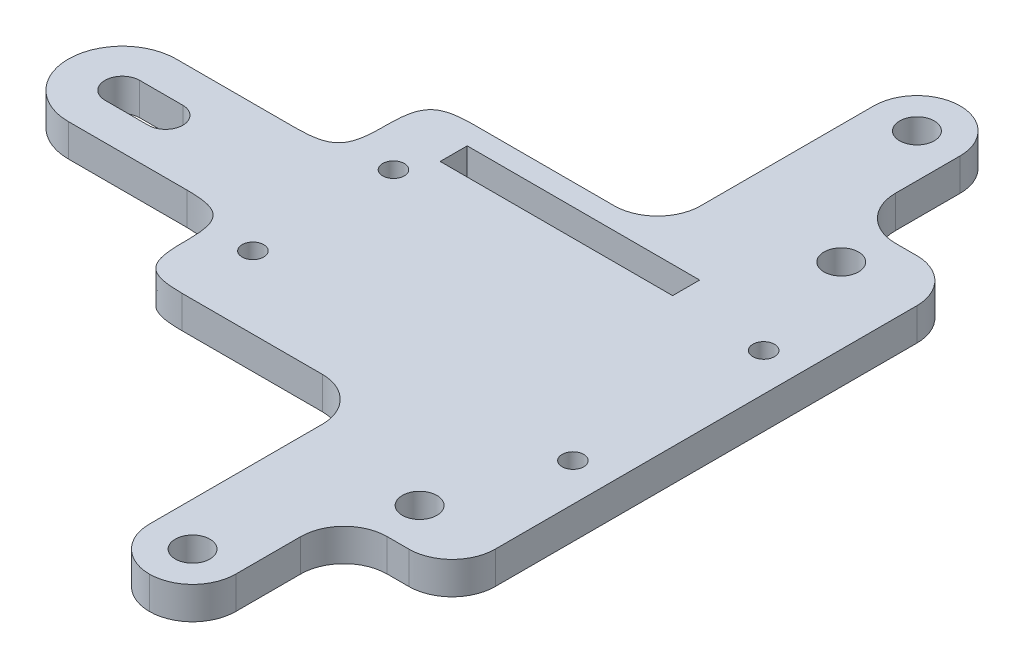
from build123d import *

# Parameters (mm, degrees)
CROQUIS1_W              = 81
CROQUIS1_H              = 47
SALIENTE_EXTRUIR1_DEPTH = 3
CORTAR_EXTRUIR2_DEPTH   = 47.920144927
CROQUIS2_R              = 1.6
CORTAR_EXTRUIR1_DEPTH   = 47.920144927
CROQUIS5_R              = 1
CROQUIS5_W              = 16
CROQUIS5_H              = 59.242740908
CROQUIS5_W_2            = 21.5
CROQUIS5_H_2            = 2.5
CORTAR_EXTRUIR4_DEPTH   = 10
CORTAR_EXTRUIR5_DEPTH   = 10
CROQUIS7_W              = 27.893037997
CROQUIS7_H              = 58.785327392
CORTAR_EXTRUIR6_DEPTH   = 10
CROQUIS8_W              = 8
CROQUIS8_H              = 24
CROQUIS8_R              = 1.6
SALIENTE_EXTRUIR2_DEPTH = 3
REDONDEO1_R             = 4
REDONDEO4_R             = 5
REDONDEO3_SIZE          = 4


# Some blends are built 0.0001 mm under size
with BuildPart() as part:
    # Croquis1 → Saliente-Extruir1 (new body)
    with BuildSketch(Plane(origin=(0, 0, 0), x_dir=(1, 0, 0), z_dir=(0, 1, 0))):
        Rectangle(CROQUIS1_W, CROQUIS1_H)
    extrude(amount=SALIENTE_EXTRUIR1_DEPTH)

    # Croquis3 → Cortar-Extruir2 (cut, through all)
    with BuildSketch(Plane(origin=(0, 3, 0), x_dir=(1, 0, 0), z_dir=(0, 1, 0))):
        Polygon((-32.5, 23.5), (23.5, 23.5), (23.5, 13.5), (-4.5, 13.5), (-4.5, 5), (-32.5, 5), align=None)
        Polygon((-32.5, -5), (-32.5, -23.5), (23.5, -23.5), (23.5, -13.5), (-4.5, -13.5), (-4.5, -5), align=None)
    extrude(amount=-CORTAR_EXTRUIR2_DEPTH, mode=Mode.SUBTRACT)

    # Croquis2 → Cortar-Extruir1 (cut, through all)
    with BuildSketch(Plane(origin=(0, 3, 0), x_dir=(1, 0, 0), z_dir=(0, 1, 0))):
        with Locations(Location((-36.5, 19.5, 0), (0, 0, 270))):
            Circle(CROQUIS2_R)
        with Locations(Location((-36.5, -19.5, 0), (0, 0, 270))):
            Circle(CROQUIS2_R)
        with Locations(Location((27.5, 19.5, 0), (0, 0, 270))):
            Circle(CROQUIS2_R)
        with Locations(Location((27.5, -19.5, 0), (0, 0, 270))):
            Circle(CROQUIS2_R)
        with Locations(Location((-36.5, 11.5, 0), (0, 0, 270))):
            Circle(CROQUIS2_R)
        with Locations(Location((-36.5, -11.5, 0), (0, 0, 270))):
            Circle(CROQUIS2_R)
    extrude(amount=-CORTAR_EXTRUIR1_DEPTH, mode=Mode.SUBTRACT)

    # Croquis5 → Cortar-Extruir4 (cut)
    with BuildSketch(Plane(origin=(0, 3, 0), x_dir=(1, 0, 0), z_dir=(0, 1, 0))):
        with Locations(Location((-0.6, 6.18, 0), (0, 0, 270))):
            Circle(CROQUIS5_R)
        with Locations(Location((31, 8.82, 0), (0, 0, 270))):
            Circle(CROQUIS5_R)
        with Locations(Location((31, -8.82, 0), (0, 0, 270))):
            Circle(CROQUIS5_R)
        with Locations(Location((-0.6, -6.82, 0), (0, 0, 270))):
            Circle(CROQUIS5_R)
        with Locations((42.5, 1.68576905)):
            Rectangle(CROQUIS5_W, CROQUIS5_H)
        with Locations((11.65, 10.25)):
            Rectangle(CROQUIS5_W_2, CROQUIS5_H_2)
    extrude(amount=-CORTAR_EXTRUIR4_DEPTH, mode=Mode.SUBTRACT)

    # Croquis6 → Cortar-Extruir5 (cut)
    with BuildSketch(Plane(origin=(0, 3, 0), x_dir=(1, 0, 0), z_dir=(0, 1, 0))):
        with BuildLine():
            Line((-19.5, 1.6), (-15.5, 1.6))
            ThreePointArc((-15.5, 1.6), (-13.9, 0), (-15.5, -1.6))
            Line((-15.5, -1.6), (-19.5, -1.6))
            ThreePointArc((-19.5, -1.6), (-21.1, 0), (-19.5, 1.6))
        make_face()
    extrude(amount=-CORTAR_EXTRUIR5_DEPTH, mode=Mode.SUBTRACT)

    # Croquis7 → Cortar-Extruir6 (cut)
    with BuildSketch(Plane(origin=(0, 3, 0), x_dir=(1, 0, 0), z_dir=(0, 1, 0))):
        with Locations((-38.446518998, -0.587422332)):
            Rectangle(CROQUIS7_W, CROQUIS7_H)
    extrude(amount=-CORTAR_EXTRUIR6_DEPTH, mode=Mode.SUBTRACT)

    # Croquis8 → Saliente-Extruir2 (add, through all)
    with BuildSketch(Plane(origin=(0, 3, 0), x_dir=(1, 0, 0), z_dir=(0, 1, 0))):
        with Locations((20.5, -25.5)):
            Rectangle(CROQUIS8_W, CROQUIS8_H)
        with Locations(Location((20.5, -33.5, 0), (0, 0, 270))):
            Circle(CROQUIS8_R, mode=Mode.SUBTRACT)
    saliente_extruir2 = extrude(amount=-SALIENTE_EXTRUIR2_DEPTH)

    # Simetría1: Saliente-Extruir2 across plane
    add(saliente_extruir2.mirror(Plane.XY))

    # Redondeo1
    redondeo1_edges = [part.edges().sort_by_distance(p)[0] for p in [
        (34.5, 1.5, 23.5),
        (34.5, 1.5, -23.5),
        (16.5, 1.5, 37.5),
        (24.5, 1.5, 37.5),
        (16.5, 1.5, 13.5),
        (24.5, 1.5, 23.5),
        (24.5, 1.5, -37.5),
        (16.5, 1.5, -37.5),
        (16.5, 1.5, -13.5),
        (24.5, 1.5, -23.5),
    ]]
    fillet(redondeo1_edges, radius=REDONDEO1_R - 0.0001)  # a hair under: the kernel refuses the full size

    # Redondeo4
    redondeo4_edges = [part.edges().sort_by_distance(p)[0] for p in [
        (-24.5, 1.5, -5),
        (-24.5, 1.5, 5),
    ]]
    fillet(redondeo4_edges, radius=REDONDEO4_R - 0.0001)  # a hair under: the kernel refuses the full size

    # Redondeo3
    # a fillet whose section is not a circle: 4 mm, written as the material it adds along each edge
    with BuildSketch(Plane(origin=(-4.5, 3, 5), x_dir=(-1, 0, 0), z_dir=(0, -1, 0))) as redondeo3_piece_1:
        with BuildLine():
            Bezier((REDONDEO3_SIZE, 0), (0, 0), (0, -REDONDEO3_SIZE), weights=[1, 1.5, 1])
            Line((0, -REDONDEO3_SIZE), (0, 0))
            Line((0, 0), (REDONDEO3_SIZE, 0))
        make_face()
    extrude(amount=3)
    with BuildSketch(Plane(origin=(-4.5, 3, -5), x_dir=(-1, 0, 0), z_dir=(0, -1, 0))) as redondeo3_piece_2:
        with BuildLine():
            Bezier((REDONDEO3_SIZE, 0), (0, 0), (0, REDONDEO3_SIZE), weights=[1, 1.5, 1])
            Line((0, REDONDEO3_SIZE), (0, 0))
            Line((0, 0), (REDONDEO3_SIZE, 0))
        make_face()
    extrude(amount=3)
    # a fillet whose section is not a circle: 4 mm, written as the material it takes off along each edge
    with BuildSketch(Plane(origin=(-4.5, 13, 13.5), x_dir=(0, 0, -1), z_dir=(0, -1, 0))) as redondeo3_2_piece_1:
        with BuildLine():
            Bezier((REDONDEO3_SIZE, 0), (0, 0), (0, REDONDEO3_SIZE), weights=[1, 1.5, 1])
            Line((0, REDONDEO3_SIZE), (0, 0))
            Line((0, 0), (REDONDEO3_SIZE, 0))
        make_face()
    extrude(amount=23, mode=Mode.SUBTRACT)
    with BuildSketch(Plane(origin=(-4.5, 13, -13.5), x_dir=(0, 0, 1), z_dir=(0, -1, 0))) as redondeo3_2_piece_2:
        with BuildLine():
            Bezier((REDONDEO3_SIZE, 0), (0, 0), (0, -REDONDEO3_SIZE), weights=[1, 1.5, 1])
            Line((0, -REDONDEO3_SIZE), (0, 0))
            Line((0, 0), (REDONDEO3_SIZE, 0))
        make_face()
    extrude(amount=23, mode=Mode.SUBTRACT)


solid = part.part
